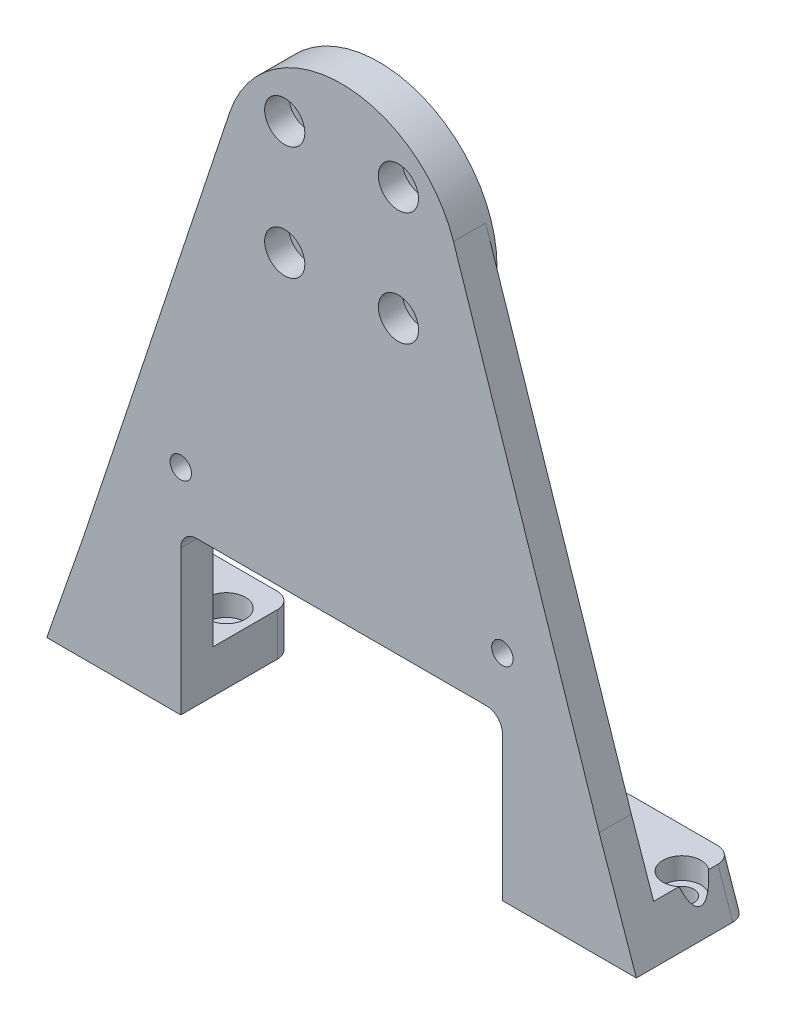
from build123d import *

# Parameters (mm, degrees)
SKETCH1_R           = 22
SKETCH1_R_2         = 2.2
BOSS_EXTRUDE1_DEPTH = 1
SKETCH2_R           = 2
SKETCH2_R_2         = 2.2
BOSS_EXTRUDE2_DEPTH = 6
SKETCH3_W           = 25
SKETCH3_H           = 15
SKETCH3_R           = 2.2
BOSS_EXTRUDE3_DEPTH = 8
CUT_EXTRUDE1_DEPTH  = 111.792599031
SKETCH5_R           = 3.55
CUT_EXTRUDE2_DEPTH  = 4
FILLET1_R           = 3
SKETCH6_R           = 3.75
CUT_EXTRUDE3_DEPTH  = 4.5


with BuildPart() as part:
    # Sketch1 → Boss-Extrude1 (new body)
    with BuildSketch(Plane.XY):
        Circle(SKETCH1_R)
        with Locations((10.606601718, 10.606601718)):
            Circle(SKETCH1_R_2, mode=Mode.SUBTRACT)
        with Locations((10.606601718, -10.606601718)):
            Circle(SKETCH1_R_2, mode=Mode.SUBTRACT)
        with Locations((-10.606601718, -10.606601718)):
            Circle(SKETCH1_R_2, mode=Mode.SUBTRACT)
        with Locations((-10.606601718, 10.606601718)):
            Circle(SKETCH1_R_2, mode=Mode.SUBTRACT)
    extrude(amount=BOSS_EXTRUDE1_DEPTH)

    # Sketch2 → Boss-Extrude2 (add)
    with BuildSketch(Plane.XY.offset(1)):
        with BuildLine():
            Line((-48.055, -75), (-55, -95))
            Line((-55, -95), (-30, -95))
            Line((-30, -95), (-30, -65))
            Line((-30, -65), (30, -65))
            Line((30, -65), (30, -95))
            Line((30, -95), (55, -95))
            Line((55, -95), (48.055, -75))
            Line((48.055, -75), (20.881333045, 6.926032793))
            ThreePointArc((20.881333045, 6.926032793), (0, 22), (-20.881333045, 6.926032793))
            Line((-20.881333045, 6.926032793), (-48.055, -75))
        make_face()
        with Locations((-30, -55)):
            Circle(SKETCH2_R, mode=Mode.SUBTRACT)
        with Locations((30, -55)):
            Circle(SKETCH2_R, mode=Mode.SUBTRACT)
        with Locations((10.606601718, -10.606601718)):
            Circle(SKETCH2_R_2, mode=Mode.SUBTRACT)
        with Locations((10.606601718, 10.606601718)):
            Circle(SKETCH2_R_2, mode=Mode.SUBTRACT)
        with Locations((-10.606601718, -10.606601718)):
            Circle(SKETCH2_R_2, mode=Mode.SUBTRACT)
        with Locations((-10.606601718, 10.606601718)):
            Circle(SKETCH2_R_2, mode=Mode.SUBTRACT)
    extrude(amount=BOSS_EXTRUDE2_DEPTH)

    # Sketch3 → Boss-Extrude3 (add)
    # profile 1 of 2: a face of its own
    with BuildSketch(Plane(origin=(0, -95, 0), x_dir=(-1, 0, 0), z_dir=(0, -1, 0))):
        with Locations((-42.5, 6.5)):
            Rectangle(SKETCH3_W, SKETCH3_H)
        with Locations((-35, 6.5)):
            Circle(SKETCH3_R, mode=Mode.SUBTRACT)
        with Locations((-50, 6.5)):
            Circle(SKETCH3_R, mode=Mode.SUBTRACT)
    # profile 2 of 2: a face of its own
    with BuildSketch(Plane(origin=(0, -95, 0), x_dir=(-1, 0, 0), z_dir=(0, -1, 0))):
        with Locations((42.5, 6.5)):
            Rectangle(SKETCH3_W, SKETCH3_H)
        with Locations((50, 6.5)):
            Circle(SKETCH3_R, mode=Mode.SUBTRACT)
        with Locations((35, 6.5)):
            Circle(SKETCH3_R, mode=Mode.SUBTRACT)
    extrude(amount=-BOSS_EXTRUDE3_DEPTH)

    # Sketch4 → Cut-Extrude1 (cut, through all)
    with BuildSketch(Plane.XY.offset(1)):
        Polygon((-55, -95), (-52.222, -87), (-55, -87), align=None)
        Polygon((55, -95), (55, -87), (52.222, -87), align=None)
    extrude(amount=-CUT_EXTRUDE1_DEPTH, mode=Mode.SUBTRACT)

    # Sketch5 → Cut-Extrude2 (cut)
    with BuildSketch(Plane(origin=(0, -87, 0), x_dir=(1, 0, 0), z_dir=(0, 1, 0))):
        with Locations((-50, 6.5)):
            Circle(SKETCH5_R)
        with Locations((-35, 6.5)):
            Circle(SKETCH5_R)
        with Locations((35, 6.5)):
            Circle(SKETCH5_R)
        with Locations((50, 6.5)):
            Circle(SKETCH5_R)
    extrude(amount=-CUT_EXTRUDE2_DEPTH, mode=Mode.SUBTRACT)

    # Fillet1
    fillet1_edges = [part.edges().sort_by_distance(p)[0] for p in [
        (-53.611, -91, -14),
        (-30, -91, -14),
        (53.611, -91, -14),
        (30, -91, -14),
        (-30, -65, 4),
        (30, -65, 4),
    ]]
    fillet(fillet1_edges, radius=FILLET1_R)

    # Sketch6 → Cut-Extrude3 (cut)
    with BuildSketch(Plane.XY.offset(7)):
        with Locations((-10.606601718, 10.606601718)):
            Circle(SKETCH6_R)
        with Locations((10.606601718, 10.606601718)):
            Circle(SKETCH6_R)
        with Locations((10.606601718, -10.606601718)):
            Circle(SKETCH6_R)
        with Locations((-10.606601718, -10.606601718)):
            Circle(SKETCH6_R)
    extrude(amount=-CUT_EXTRUDE3_DEPTH, mode=Mode.SUBTRACT)


solid = part.part
